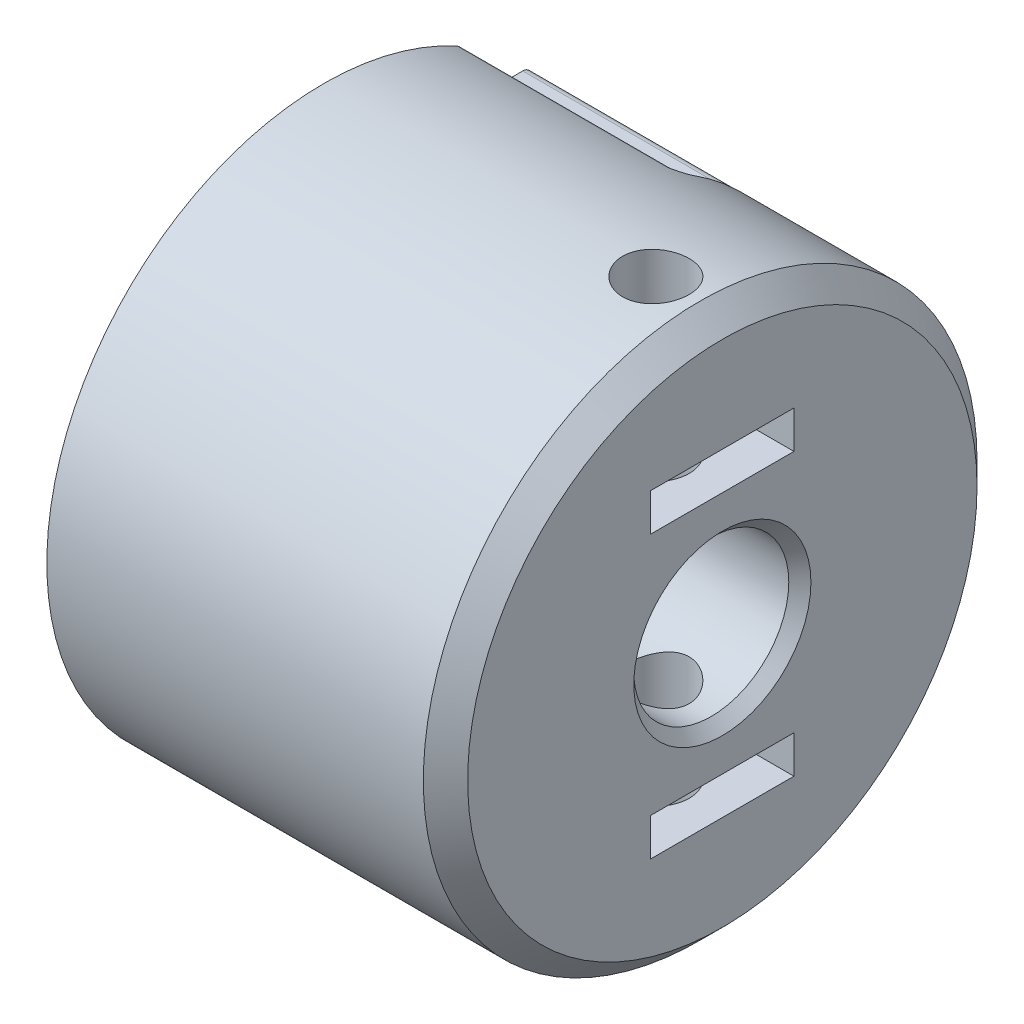
from build123d import *

# Parameters (mm, degrees)
CUT_EXTRUDE1_DEPTH       = 22.365860619
CUT_EXTRUDE1_DEPTH_BACK  = 22.365860619
SKETCH2_R                = 1.5
SKETCH3_W                = 9.16515139
SKETCH3_H                = 1.7
CUT_EXTRUDE2_DEPTH       = 21.310096204
FILLET1_R                = 0.4
BOSS_EXTRUDE1_START      = 19.2405
SKETCH4_R                = 6.5
SKETCH4_R_2              = 3
BOSS_EXTRUDE1_DEPTH      = 19.2405
CHAMFER1_SIZE            = 1.5
CHAMFER2_SIZE            = 0.5
FILLET2_R                = 0.5
CUT_EXTRUDE3_START       = -19.2405
CUT_EXTRUDE3_OUTLINE_R   = 7.963373885
CUT_EXTRUDE3_OUTLINE_R_2 = 3
CUT_EXTRUDE3_DEPTH       = 19.2405
SKETCH6_R                = 3.5
CUT_EXTRUDE4_DEPTH       = 10
CHAMFER3_SIZE            = 0.5
SKETCH7_R                = 10.7
CUT_EXTRUDE5_DEPTH       = 10
CUT_EXTRUDE6_START       = 5.5
CUT_EXTRUDE6_DEPTH       = 1.7
CHAMFER5_SIZE            = 1


# Read off the part's stored shape, not the designer's step: Cut-Extrude3
with BuildPart() as part:
    # Sketch1 → Revolve1 (revolve)
    with BuildSketch(Plane.XY, mode=Mode.PRIVATE) as revolve1_sk:
        Polygon((-12, 12.5), (0, 12.5), (6, 12.5), (6, 10), (6, 3), (-2, 3), (-2, 10.2), (-12, 10.2), align=None)
    revolve(revolve1_sk.sketch.rotate(Axis((88.99, 0, 0), (-1, 0, 0)), 90), axis=Axis((88.99, 0, 0), (-1, 0, 0)))

    # Sketch2 → Cut-Extrude1 (cut, two sides: drawn at the far end of the back side and taken through both)
    with BuildSketch(Plane(origin=(0, 0, 0), x_dir=(1, 0, 0), z_dir=(0, 1, 0)).offset(-CUT_EXTRUDE1_DEPTH_BACK)):
        with Locations(Location((3, 0, 0), (0, 0, 90))):
            Circle(SKETCH2_R)
    extrude(amount=CUT_EXTRUDE1_DEPTH + CUT_EXTRUDE1_DEPTH_BACK, mode=Mode.SUBTRACT)

    # Sketch3 → Cut-Extrude2 (cut, through all)
    with BuildSketch(Plane.ZY.offset(2)):
        with Locations((-4.582575695, 9.35)):
            Rectangle(SKETCH3_W, SKETCH3_H)
    extrude(amount=CUT_EXTRUDE2_DEPTH, mode=Mode.SUBTRACT)

    # Fillet1
    fillet1_edges = [part.edges().sort_by_distance(p)[0] for p in [
        (-7, 8.5, -5.638262144),
        (-7, 10.2, -7.22564876),
        (-7, 8.5, -9.16515139),
    ]]
    fillet(fillet1_edges, radius=FILLET1_R)

    # Sketch4 → Boss-Extrude1 (add)
    with BuildSketch(Plane.ZY.offset(2).offset(BOSS_EXTRUDE1_START)):
        Circle(SKETCH4_R)
        with Locations(Location((0, 0, 0), (0, 0, 180))):
            Circle(SKETCH4_R_2, mode=Mode.SUBTRACT)
    extrude(amount=-BOSS_EXTRUDE1_DEPTH)

    # Chamfer1
    chamfer1_edges = [part.edges().sort_by_distance(p)[0] for p in [
        (-21.2405, 0, -6.5),
        (-21.2405, 0, 3),
    ]]
    chamfer(chamfer1_edges, length=CHAMFER1_SIZE)

    # Chamfer2
    chamfer2_edges = [part.edges().sort_by_distance(p)[0] for p in [
        (6, 0, 3),
    ]]
    chamfer(chamfer2_edges, length=CHAMFER2_SIZE)

    # Fillet2
    # the kernel refuses this fillet: 0.5 mm, written as the material it adds along each edge
    with BuildSketch(Plane(origin=(-2, 0, 0), x_dir=(0, 0.7641509433962261, -0.6450374684517619), z_dir=(0, 0.6450374684517619, 0.7641509433962261))) as fillet2_piece_1:
        with BuildLine():
            CenterArc((10.2 - FILLET2_R, FILLET2_R), FILLET2_R, 270, 90)
            Line((10.2, FILLET2_R), (10.2, 0))
            Line((10.2, 0), (10.2 - FILLET2_R, 0))
        make_face()
    revolve(axis=Axis((-2, 0, 0), (-1, 0, 0)), revolution_arc=319.831515217)
    with BuildSketch(Plane(origin=(-2, 10.2, 0), x_dir=(0, -1, 0), z_dir=(0, 0, -1))) as fillet2_piece_2:
        with BuildLine():
            CenterArc((FILLET2_R, FILLET2_R), FILLET2_R, 180, 90)
            Line((0, FILLET2_R), (0, 0))
            Line((0, 0), (FILLET2_R, 0))
        make_face()
    extrude(amount=5.835237784)
    with BuildSketch(Plane(origin=(-2, 8.5, -8.988882022), x_dir=(0, 1, 0), z_dir=(0, 0, 1))) as fillet2_piece_3_section:
        with BuildLine():
            CenterArc((FILLET2_R, FILLET2_R), FILLET2_R, 180, 90)
            Line((0, FILLET2_R), (0, 0))
            Line((0, 0), (FILLET2_R, 0))
        make_face()
    fillet2_piece_3 = extrude(amount=2.151484856, mode=Mode.PRIVATE)
    fillet2_piece_3 = fillet2_piece_3 & Plane(origin=(-2.112337318, 0, 0), x_dir=(0, 0, -1), z_dir=(1, 0, 0)) * Cylinder(12.5, 7, mode=Mode.PRIVATE)
    add(fillet2_piece_3)
    with BuildSketch(Plane(origin=(-2, 8.1, -6.837397166), x_dir=(0, -0.7641509433962268, 0.6450374684517612), z_dir=(0, -0.6450374684517612, -0.7641509433962268))) as fillet2_piece_4:
        with BuildLine():
            CenterArc((0.4 + FILLET2_R, FILLET2_R), FILLET2_R, 180, 90)
            Line((0.4, FILLET2_R), (0.4, 0))
            Line((0.4, 0), (0.4 + FILLET2_R, 0))
        make_face()
    revolve(axis=Axis((-2, 8.1, -6.837397166), (-1, 0, 0)), revolution_arc=139.831515217)
    with BuildSketch(Plane(origin=(-2, 8.1, -8.988882022), x_dir=(0, -0.6813941617388248, 0.7319166594280009), z_dir=(0, 0.7319166594280009, 0.6813941617388248))) as fillet2_piece_5_section:
        with BuildLine():
            CenterArc((0.4 + FILLET2_R, -FILLET2_R), FILLET2_R, 90, 90)
            Line((0.4, -FILLET2_R), (0.4, 0))
            Line((0.4, 0), (0.4 + FILLET2_R, 0))
        make_face()
    fillet2_piece_5 = revolve(axis=Axis((-2, 8.1, -8.988882022), (1, 0, 0)), revolution_arc=227.047315948, mode=Mode.PRIVATE)
    fillet2_piece_5 = fillet2_piece_5 & Plane(origin=(-2.20433756, 0, 0), x_dir=(0, 0, -1), z_dir=(1, 0, 0)) * Cylinder(12.5, 4, mode=Mode.PRIVATE)
    add(fillet2_piece_5)
    with BuildSketch(Plane(origin=(-2, 10.6, -5.835237784), x_dir=(0, -0.8696656127523182, 0.49364128878785535), z_dir=(0, -0.49364128878785535, -0.8696656127523182))) as fillet2_piece_6_section:
        with BuildLine():
            CenterArc((0.4 + FILLET2_R, FILLET2_R), FILLET2_R, 180, 90)
            Line((0.4 + FILLET2_R, 0), (0.4, 0))
            Line((0.4, 0), (0.4, FILLET2_R))
        make_face()
    fillet2_piece_6 = revolve(axis=Axis((-2, 10.6, -5.835237784), (-1, 0, 0)), revolution_arc=330.419804772, mode=Mode.PRIVATE)
    fillet2_piece_6 = fillet2_piece_6 & Plane(origin=(-2.048284791, 0, 0), x_dir=(0, 0, -1), z_dir=(1, 0, 0)) * Cylinder(12.5, 4, mode=Mode.PRIVATE)
    add(fillet2_piece_6)
    with BuildSketch(Plane(origin=(-2, 0, 0), x_dir=(0, 0, 1), z_dir=(0, -1, 0))) as fillet2_piece_7:
        with BuildLine():
            CenterArc((6.5 + FILLET2_R, FILLET2_R), FILLET2_R, 180, 90)
            Line((6.5, FILLET2_R), (6.5, 0))
            Line((6.5, 0), (6.5 + FILLET2_R, 0))
        make_face()
    revolve(axis=Axis((-2, 0, 0), (-1, 0, 0)))

    # Cut-Extrude3 outline → Cut-Extrude3 (cut)
    with BuildSketch(Plane.ZY.offset(21.2405).offset(CUT_EXTRUDE3_START)):
        Circle(CUT_EXTRUDE3_OUTLINE_R)
        Circle(CUT_EXTRUDE3_OUTLINE_R_2, mode=Mode.SUBTRACT)
    extrude(amount=CUT_EXTRUDE3_DEPTH, mode=Mode.SUBTRACT)

    # Sketch6 → Cut-Extrude4 (cut)
    with BuildSketch(Plane(origin=(6, 0, 0), x_dir=(0, 0, -1), z_dir=(1, 0, 0))):
        Circle(SKETCH6_R)
    extrude(amount=-CUT_EXTRUDE4_DEPTH, mode=Mode.SUBTRACT)

    # Chamfer3
    chamfer3_edges = [part.edges().sort_by_distance(p)[0] for p in [
        (6, 0, 3.5),
    ]]
    chamfer(chamfer3_edges, length=CHAMFER3_SIZE)

    # Sketch7 → Cut-Extrude5 (cut)
    with BuildSketch(Plane.ZY.offset(12)):
        Circle(SKETCH7_R)
    extrude(amount=-CUT_EXTRUDE5_DEPTH, mode=Mode.SUBTRACT)

    # Sketch8 → Cut-Extrude6 (cut)
    with BuildSketch(Plane(origin=(0, 0, 0), x_dir=(1, 0, 0), z_dir=(0, 1, 0)).offset(CUT_EXTRUDE6_START)):
        Polygon((0.2, 1.616580754), (0.2, -1.616580754), (0.2, -2.424871131), (3, -3.233161507), (4.318553482, -3.233161507), (8.377038533, -3.233161507), (8.377038533, 3.233161507), (4.318553482, 3.233161507), (3, 3.233161507), (0.2, 2.424871131), align=None)
    cut_extrude6 = extrude(amount=CUT_EXTRUDE6_DEPTH, mode=Mode.SUBTRACT)

    # Chamfer5
    chamfer5_edges = [part.edges().sort_by_distance(p)[0] for p in [
        (6, 0, 12.5),
    ]]
    chamfer(chamfer5_edges, length=CHAMFER5_SIZE)

    # Mirror1: Cut-Extrude6 across plane
    add(cut_extrude6.mirror(Plane.ZX), mode=Mode.SUBTRACT)


solid = part.part
